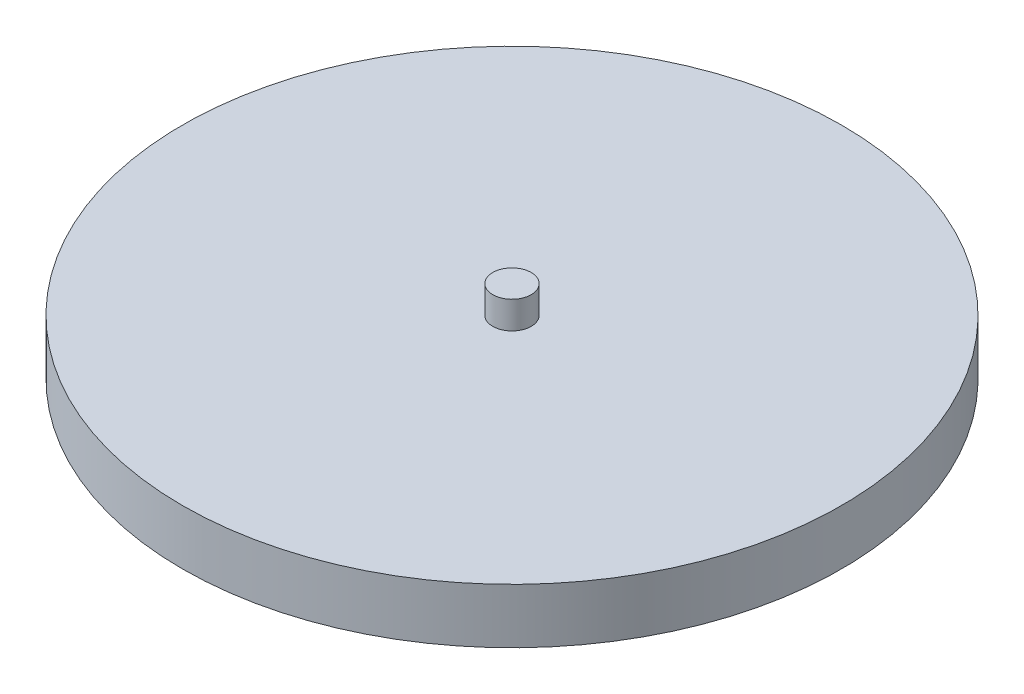
from build123d import *

# Parameters (mm, degrees)
SKETCH1_R           = 60
BOSS_EXTRUDE1_DEPTH = 10
SKETCH2_R           = 3.5
BOSS_EXTRUDE2_DEPTH = 5


with BuildPart() as part:
    # Sketch1 → Boss-Extrude1 (new body)
    with BuildSketch(Plane(origin=(0, 0, 0), x_dir=(1, 0, 0), z_dir=(0, 1, 0))):
        Circle(SKETCH1_R)
    extrude(amount=BOSS_EXTRUDE1_DEPTH)

    # Sketch2 → Boss-Extrude2 (add)
    with BuildSketch(Plane(origin=(0, 10, 0), x_dir=(1, 0, 0), z_dir=(0, 1, 0))):
        Circle(SKETCH2_R)
    extrude(amount=BOSS_EXTRUDE2_DEPTH)


solid = part.part
